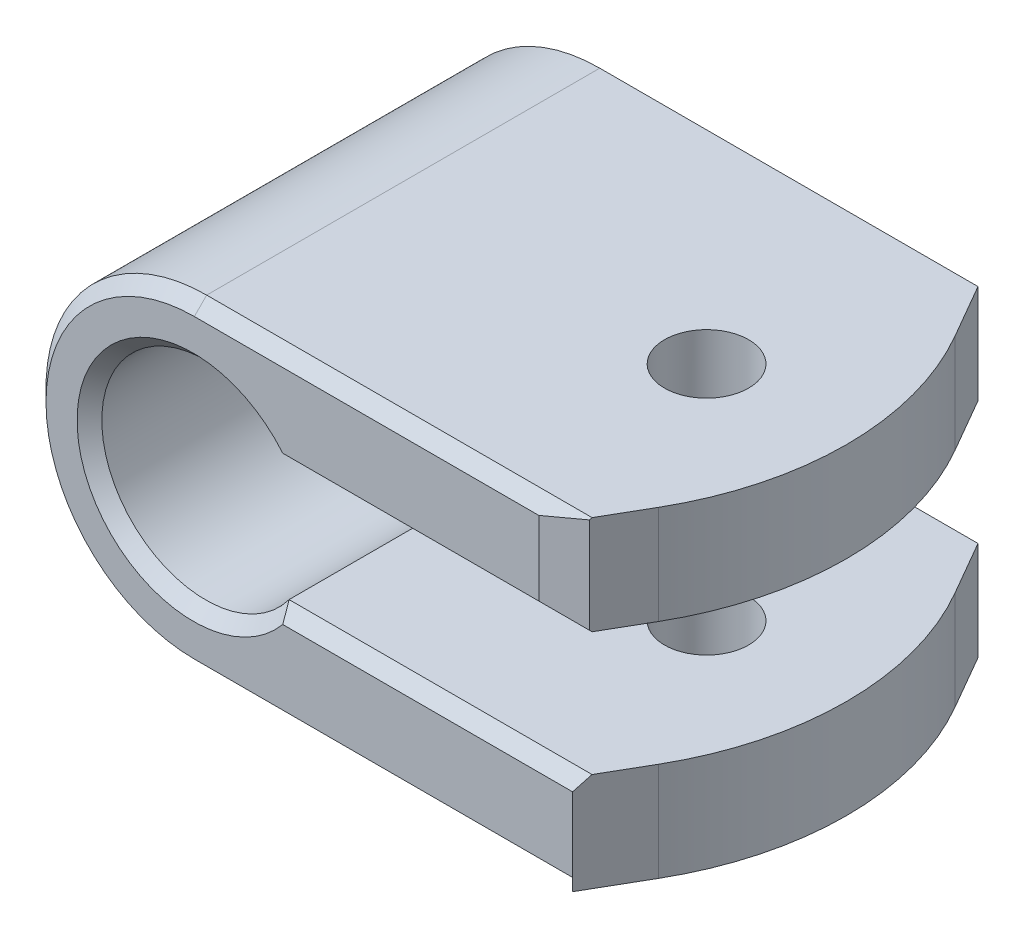
from build123d import *
from OCP.BRepFilletAPI import BRepFilletAPI_MakeChamfer

# Parameters (mm, degrees)
BOSS_EXTRUDE1_DEPTH     = 16.399996177
CUT_EXTRUDE1_DEPTH      = 32.345970628
CUT_EXTRUDE3_DEPTH      = 30.26106414
CUT_EXTRUDE3_DEPTH_BACK = 30.26106414
SKETCH4_R               = 1.7
BOSS_EXTRUDE2_START     = -4
BOSS_EXTRUDE2_DEPTH     = 4
FILLET1_R               = 12
CHAMFER1_SIZE           = 0.5
CHAMFER2_SIZE           = 0.5
CHAMFER2_SIZE2          = 1.366025404
MIRROR2_START           = 1.4
MIRROR2_DEPTH           = 9
CUT_EXTRUDE4_DEPTH      = 31.847364144
BOSS_EXTRUDE4_DEPTH     = 2.3
CHAMFER3_SIZE           = 2.3


# Read off the part's stored shape, not the designer's step: Mirror2
with BuildPart() as part:
    # Sketch1 → Boss-Extrude1 (new body)
    with BuildSketch(Plane.XY.offset(16.399996177)):
        with BuildLine():
            Line((7.2, 1.4), (22.5, 1.4))
            Line((22.5, 1.4), (22.5, 14.4))
            Line((22.5, 14.4), (7.2, 14.4))
            ThreePointArc((7.2, 14.4), (0.7, 7.9), (7.2, 1.4))
        make_face()
    extrude(amount=-BOSS_EXTRUDE1_DEPTH)

    # Sketch2 → Cut-Extrude1 (cut, through all)
    with BuildSketch(Plane(origin=(0, 0, 0), x_dir=(-1, 0, 0), z_dir=(0, 0, -1))):
        with BuildLine():
            Line((-22.5, 10.4), (-22.5, 5.4))
            Line((-22.5, 5.4), (-10.532688106, 5.4))
            ThreePointArc((-10.532688106, 5.4), (-2.9577807, 7.9), (-10.532688106, 10.4))
            Line((-10.532688106, 10.4), (-22.5, 10.4))
        make_face()
    extrude(amount=-CUT_EXTRUDE1_DEPTH, mode=Mode.SUBTRACT)

    # Sketch4 → Cut-Extrude3 (cut, two sides: drawn at the far end of the back side and taken through both)
    with BuildSketch(Plane.XZ.offset(-10.4).offset(-CUT_EXTRUDE3_DEPTH_BACK)):
        with Locations((19.72, 8.2)):
            Circle(SKETCH4_R)
    extrude(amount=CUT_EXTRUDE3_DEPTH + CUT_EXTRUDE3_DEPTH_BACK, mode=Mode.SUBTRACT)

    # Sketch5 → Boss-Extrude2 (add)
    with BuildSketch(Plane(origin=(0, 14.4, 0), x_dir=(1, 0, 0), z_dir=(0, 1, 0)).offset(BOSS_EXTRUDE2_START)):
        Polygon((22.5, 0), (22.5, -16.399996177), (27.234271104, -8.199998088), align=None)
    extrude(amount=BOSS_EXTRUDE2_DEPTH)

    # Fillet1
    fillet1_edges = [part.edges().sort_by_distance(p)[0] for p in [
        (27.234271104, 12.4, 8.199998088),
    ]]
    fillet(fillet1_edges, radius=FILLET1_R)

    # Chamfer1
    chamfer1_edges = [part.edges().sort_by_distance(p)[0] for p in [
        (2.9577807, 7.9, 16.399996177),
    ]]
    chamfer(chamfer1_edges, length=CHAMFER1_SIZE)

    # Chamfer2: one chamfer whose edges measure the first distance from different faces: ONE call of the kernel's chamfer builder (chamfer() names one face for all edges)
    chamfer2_edges_1 = [part.edges().sort_by_distance(p)[0] for p in [
        (22.5, 12.4, 16.399996177),
    ]]
    chamfer2_side_1 = [part.faces().sort_by_distance(p)[0] for p in [
        (23.135084744, 12.4, 15.299997133),
    ]]
    chamfer2_edges_2 = [part.edges().sort_by_distance(p)[0] for p in [
        (14.85, 1.4, 16.399996177),
        (0.7, 7.9, 16.399996177),
        (14.85, 14.4, 16.399996177),
        (16.818865224, 10.4, 16.399996177),
        (16.818865224, 5.4, 16.399996177),
    ]]
    chamfer2 = BRepFilletAPI_MakeChamfer(part.part.solid().wrapped)
    for e in chamfer2_edges_1:
        chamfer2.Add(CHAMFER2_SIZE, CHAMFER2_SIZE2, e.wrapped, chamfer2_side_1[0].wrapped)  # the first distance lies on this face
    for e in chamfer2_edges_2:
        chamfer2.Add(CHAMFER2_SIZE, e.wrapped)
    add(Compound.cast(chamfer2.Shape()), mode=Mode.REPLACE)

    # Mirror2 outline → Mirror2 (add)
    with BuildSketch(Plane(origin=(0, 0, 0), x_dir=(1, 0, 0), z_dir=(0, 1, 0)).offset(MIRROR2_START)):
        with BuildLine():
            ThreePointArc((23.770169489, -14.199998088), (25.377864643, -8.199998088), (23.770169489, -2.199998088))
            Line((23.770169489, -2.199998088), (22.5, 0))
            Line((22.5, 0), (22.5, -16.399996177))
            Line((22.5, -16.399996177), (23.770169489, -14.199998088))
        make_face()
    extrude(amount=MIRROR2_DEPTH)

    # Sketch7 → Cut-Extrude4 (cut, through all)
    with BuildSketch(Plane.ZY.offset(-22.5)):
        Polygon((0, 10.4), (0, 5.4), (15.899996177, 5.4), (16.399996177, 4.9), (16.399996177, 10.4), (15.899996177, 10.4), align=None)
    extrude(amount=-CUT_EXTRUDE4_DEPTH, mode=Mode.SUBTRACT)

    # Sketch9 → Boss-Extrude4 (add)
    with BuildSketch(Plane.XZ.offset(-1.4)):
        Polygon((16.891066023, 3.300146444), (22.548930666, 3.300144532), (25.377864643, 8.199998088), (22.548933977, 13.099853556), (16.891069334, 13.099855468), (14.062135357, 8.200001912), align=None)
        Polygon((21.32, 10.971281292), (18.12, 10.971281292), (16.52, 8.2), (18.12, 5.428718708), (21.32, 5.428718708), (22.92, 8.2), align=None, mode=Mode.SUBTRACT)
    extrude(amount=BOSS_EXTRUDE4_DEPTH)

    # Chamfer3
    # the kernel refuses this chamfer: 2.3 mm, written as the material it takes off along each edge
    with BuildSketch(Plane(origin=(19.591493499, -0.9, -1.822282904), x_dir=(0.023812122999065932, 0.9996219169112968, -0.013747946350707228), z_dir=(0.5000002926043912, 0, 0.8660252348491488))) as chamfer3_piece_1_section:
        Polygon((CHAMFER3_SIZE * 0.999621916911, CHAMFER3_SIZE * 0.0274958766106), (-CHAMFER3_SIZE * 0.0274958766106, CHAMFER3_SIZE * 0.999621916911), (0, 0), align=None)
    chamfer3_piece_1 = extrude(amount=17.487606388, mode=Mode.PRIVATE)
    chamfer3_piece_1 = split(chamfer3_piece_1, bisect_by=Plane(origin=(23.305279483, 1.4, 6.13003631), z_dir=(0, -1, 0)), keep=Keep.TOP, mode=Mode.PRIVATE)
    add(chamfer3_piece_1, mode=Mode.SUBTRACT)
    with BuildSketch(Plane(origin=(10.976195151, -0.9, 3.300148442), x_dir=(-9.290045060267903e-09, 0.9996219169112968, -0.027495876610584728), z_dir=(0.999999999999943, 0, -3.378704806423189e-07))) as chamfer3_piece_2_section:
        Polygon((CHAMFER3_SIZE * 0.999621916911, CHAMFER3_SIZE * 0.0274958766106), (-CHAMFER3_SIZE * 0.0274958766106, CHAMFER3_SIZE * 0.999621916911), (0, 0), align=None)
    chamfer3_piece_2 = extrude(amount=17.487606388, mode=Mode.PRIVATE)
    chamfer3_piece_2 = split(chamfer3_piece_2, bisect_by=Plane(origin=(19.719998601, 1.4, 4.060075043), z_dir=(0, -1, 0)), keep=Keep.TOP, mode=Mode.PRIVATE)
    add(chamfer3_piece_2, mode=Mode.SUBTRACT)
    with BuildSketch(Plane(origin=(11.104701651, -0.9, 13.322431346), x_dir=(-0.023812132289111273, 0.9996219169112968, -0.013747930259877354), z_dir=(0.49999970739555216, 0, -0.8660255727196295))) as chamfer3_piece_3_section:
        Polygon((CHAMFER3_SIZE * 0.999621916911, CHAMFER3_SIZE * 0.0274958766106), (-CHAMFER3_SIZE * 0.0274958766106, CHAMFER3_SIZE * 0.999621916911), (0, 0), align=None)
    chamfer3_piece_3 = extrude(amount=17.487606388, mode=Mode.PRIVATE)
    chamfer3_piece_3 = split(chamfer3_piece_3, bisect_by=Plane(origin=(16.134719118, 1.4, 6.130038733), z_dir=(0, -1, 0)), keep=Keep.TOP, mode=Mode.PRIVATE)
    add(chamfer3_piece_3, mode=Mode.SUBTRACT)
    with BuildSketch(Plane(origin=(19.848506501, -0.9, 18.222282904), x_dir=(-0.023812122999067282, 0.9996219169112966, 0.013747946350707963), z_dir=(-0.5000002926043904, 0, -0.8660252348491492))) as chamfer3_piece_4_section:
        Polygon((CHAMFER3_SIZE * 0.999621916911, CHAMFER3_SIZE * 0.0274958766106), (-CHAMFER3_SIZE * 0.0274958766106, CHAMFER3_SIZE * 0.999621916911), (0, 0), align=None)
    chamfer3_piece_4 = extrude(amount=17.487606388, mode=Mode.PRIVATE)
    chamfer3_piece_4 = split(chamfer3_piece_4, bisect_by=Plane(origin=(16.134720517, 1.4, 10.26996369), z_dir=(0, -1, 0)), keep=Keep.TOP, mode=Mode.PRIVATE)
    add(chamfer3_piece_4, mode=Mode.SUBTRACT)
    with BuildSketch(Plane(origin=(28.335298349, -0.9, 3.077568654), x_dir=(0.02381213228911159, 0.9996219169112966, 0.013747930259877545), z_dir=(-0.499999707395552, 0, 0.8660255727196297))) as chamfer3_piece_5_section:
        Polygon((CHAMFER3_SIZE * 0.999621916911, CHAMFER3_SIZE * 0.0274958766106), (-CHAMFER3_SIZE * 0.0274958766106, CHAMFER3_SIZE * 0.999621916911), (0, 0), align=None)
    chamfer3_piece_5 = extrude(amount=17.487606388, mode=Mode.PRIVATE)
    chamfer3_piece_5 = split(chamfer3_piece_5, bisect_by=Plane(origin=(23.305280882, 1.4, 10.269961267), z_dir=(0, -1, 0)), keep=Keep.TOP, mode=Mode.PRIVATE)
    add(chamfer3_piece_5, mode=Mode.SUBTRACT)
    with BuildSketch(Plane(origin=(28.463804849, -0.9, 13.099851558), x_dir=(9.290045031933457e-09, 0.9996219169112968, 0.027495876610584735), z_dir=(-0.9999999999999429, 0, 3.3787048064231847e-07))) as chamfer3_piece_6_section:
        Polygon((CHAMFER3_SIZE * 0.999621916911, CHAMFER3_SIZE * 0.0274958766106), (-CHAMFER3_SIZE * 0.0274958766106, CHAMFER3_SIZE * 0.999621916911), (0, 0), align=None)
    chamfer3_piece_6 = extrude(amount=17.487606388, mode=Mode.PRIVATE)
    chamfer3_piece_6 = split(chamfer3_piece_6, bisect_by=Plane(origin=(19.720001399, 1.4, 12.339924957), z_dir=(0, -1, 0)), keep=Keep.TOP, mode=Mode.PRIVATE)
    add(chamfer3_piece_6, mode=Mode.SUBTRACT)


solid = part.part
